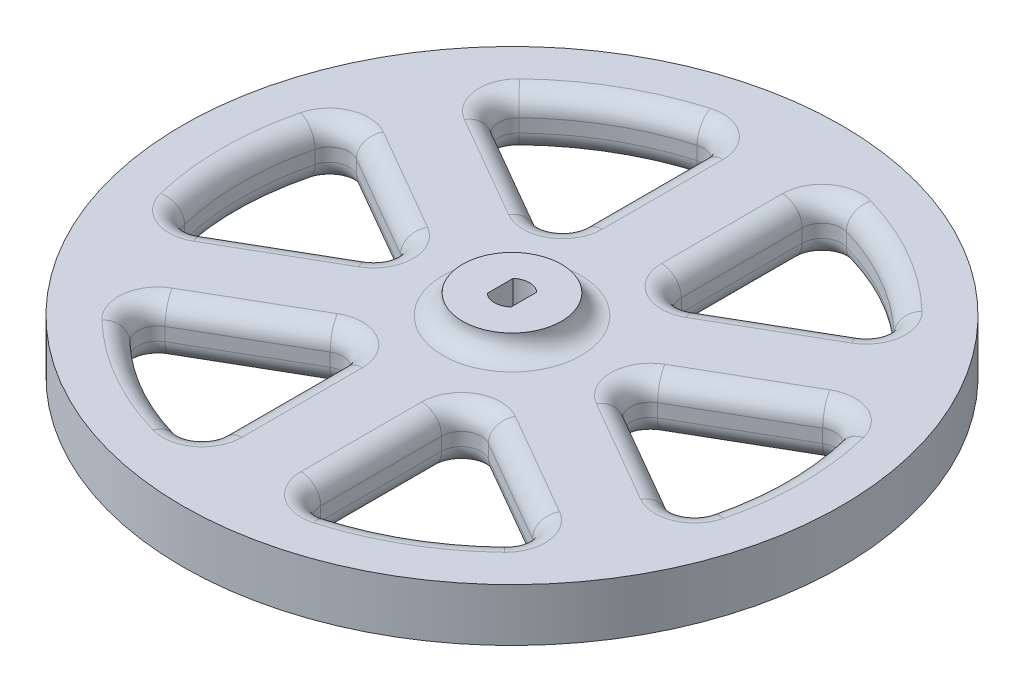
from build123d import *

# Parameters (mm, degrees)
SKETCH1_R           = 50
BOSS_EXTRUDE1_DEPTH = 8
SKETCH2_R           = 7.5
BOSS_EXTRUDE4_DEPTH = 3
CUT_EXTRUDE4_DEPTH  = 72.161787499
CUT_EXTRUDE6_DEPTH  = 72.161787499
FILLET4_R           = 3
FILLET5_R           = 3
FILLET6_R           = 3
FILLET7_R           = 3
FILLET8_R           = 3


with BuildPart() as part:
    # Sketch1 → Boss-Extrude1 (new body)
    with BuildSketch(Plane(origin=(0, 0, 0), x_dir=(1, 0, 0), z_dir=(0, 1, 0))):
        with Locations(Location((0, 0, 0), (0, 0, 270))):
            Circle(SKETCH1_R)
    extrude(amount=BOSS_EXTRUDE1_DEPTH)

    # Sketch2 → Boss-Extrude4 (add)
    with BuildSketch(Plane(origin=(0, 8, 0), x_dir=(1, 0, 0), z_dir=(0, 1, 0))):
        with Locations(Location((0, 0, 0), (0, 0, 270))):
            Circle(SKETCH2_R)
        with BuildLine():
            Line((-1.8, 1.944865034), (-1.8, -1.944865034))
            ThreePointArc((-1.8, -1.944865034), (0, -2.65), (1.8, -1.944865034))
            Line((1.8, -1.944865034), (1.8, 1.944865034))
            ThreePointArc((1.8, 1.944865034), (0, 2.65), (-1.8, 1.944865034))
        make_face(mode=Mode.SUBTRACT)
    extrude(amount=BOSS_EXTRUDE4_DEPTH)

    # Sketch5 → Cut-Extrude4 (cut, through all)
    with BuildSketch(Plane(origin=(0, 8, 0), x_dir=(1, 0, 0), z_dir=(0, 1, 0))):
        with BuildLine():
            Line((-1.8, 1.944865034), (-1.8, -1.944865034))
            ThreePointArc((-1.8, -1.944865034), (0, -2.65), (1.8, -1.944865034))
            Line((1.8, -1.944865034), (1.8, 1.944865034))
            ThreePointArc((1.8, 1.944865034), (0, 2.65), (-1.8, 1.944865034))
        make_face()
    extrude(amount=-CUT_EXTRUDE4_DEPTH, mode=Mode.SUBTRACT)

    # Sketch7 → Cut-Extrude6 (cut, through all)
    with BuildSketch(Plane(origin=(0, 8, 0), x_dir=(1, 0, 0), z_dir=(0, 1, 0))):
        with BuildLine():
            Line((-7.5, 40.308187754), (-7.5, 12.990381057))
            Line((-7.5, 12.990381057), (-31.157914575, 26.649284405))
            ThreePointArc((-31.157914575, 26.649284405), (-20.5, 35.507041555), (-7.5, 40.308187754))
        make_face()
        with BuildLine():
            Line((7.5, -40.308187754), (7.5, -12.990381057))
            Line((7.5, -12.990381057), (31.157914575, -26.649284405))
            ThreePointArc((31.157914575, -26.649284405), (20.5, -35.507041555), (7.5, -40.308187754))
        make_face()
        with BuildLine():
            Line((-38.657914575, 13.658903349), (-15, 0))
            Line((-15, 0), (-38.657914575, -13.658903349))
            ThreePointArc((-38.657914575, -13.658903349), (-41, 0), (-38.657914575, 13.658903349))
        make_face()
        with BuildLine():
            Line((-31.157914575, -26.649284405), (-7.5, -12.990381057))
            Line((-7.5, -12.990381057), (-7.5, -40.308187754))
            ThreePointArc((-7.5, -40.308187754), (-20.5, -35.507041555), (-31.157914575, -26.649284405))
        make_face()
        with BuildLine():
            Line((7.5, 12.990381057), (31.157914575, 26.649284405))
            ThreePointArc((31.157914575, 26.649284405), (20.5, 35.507041555), (7.5, 40.308187754))
            Line((7.5, 40.308187754), (7.5, 12.990381057))
        make_face()
        with BuildLine():
            Line((15, 0), (38.657914575, -13.658903349))
            ThreePointArc((38.657914575, -13.658903349), (41, 0), (38.657914575, 13.658903349))
            Line((38.657914575, 13.658903349), (15, 0))
        make_face()
    extrude(amount=-CUT_EXTRUDE6_DEPTH, mode=Mode.SUBTRACT)

    # Fillet4
    fillet4_edges = [part.edges().sort_by_distance(p)[0] for p in [
        (0, 8, -7.5),
    ]]
    fillet(fillet4_edges, radius=FILLET4_R - 0.0001)  # a hair under: the kernel refuses the full size

    # Fillet5
    fillet5_edges = [part.edges().sort_by_distance(p)[0] for p in [
        (7.5, 4, -40.308187754),
        (31.157914575, 4, -26.649284405),
        (31.157914575, 4, 26.649284405),
        (7.5, 4, 40.308187754),
        (38.657914575, 4, -13.658903349),
        (38.657914575, 4, 13.658903349),
        (-38.657914575, 4, 13.658903349),
        (-38.657914575, 4, -13.658903349),
        (-31.157914575, 4, -26.649284405),
        (-7.5, 4, -40.308187754),
        (-7.5, 4, 40.308187754),
        (-31.157914575, 4, 26.649284405),
    ]]
    fillet(fillet5_edges, radius=FILLET5_R)

    # Fillet6
    fillet6_edges = [part.edges().sort_by_distance(p)[0] for p in [
        (7.5, 4, -12.990381057),
        (7.5, 4, 12.990381057),
        (15, 4, 0),
        (-15, 4, 0),
        (-7.5, 4, -12.990381057),
        (-7.5, 4, 12.990381057),
    ]]
    fillet(fillet6_edges, radius=FILLET6_R)

    # Fillet7
    fillet7_edges = [part.edges().sort_by_distance(p)[0] for p in [
        (-19.938858637, 8, -20.171959439),
        (-20.5, 8, -35.507041555),
        (-20.5, 8, 35.507041555),
        (-41, 8, 0),
        (7.5, 8, -27.353537822),
        (20.5, 8, -35.507041555),
        (27.438858637, 8, -7.181578383),
        (41, 8, 0),
        (19.938858637, 8, 20.171959439),
        (20.5, 8, 35.507041555),
        (-7.5, 8, 27.353537822),
        (-27.438858637, 8, 7.181578383),
        (-29.355484575, 8, -26.988980691),
        (-29.355484575, 8, 26.988980691),
        (-38.050885189, 8, -11.928105037),
        (-8.695400613, 8, -38.917085728),
        (8.695400613, 8, -38.917085728),
        (38.050885189, 8, -11.928105037),
        (29.355484575, 8, 26.988980691),
        (-8.695400613, 8, 38.917085728),
        (-38.050885189, 8, 11.928105037),
        (8.695400613, 8, 38.917085728),
        (38.050885189, 8, 11.928105037),
        (29.355484575, 8, -26.988980691),
        (-27.438858637, 8, -7.181578383),
        (-19.938858637, 8, 20.171959439),
        (7.5, 8, 27.353537822),
        (27.438858637, 8, 7.181578383),
        (19.938858637, 8, -20.171959439),
        (-7.5, 8, -27.353537822),
        (-18, 8, 0),
        (-9, 8, 15.588457268),
        (9, 8, 15.588457268),
        (18, 8, 0),
        (9, 8, -15.588457268),
        (-9, 8, -15.588457268),
    ]]
    fillet(fillet7_edges, radius=FILLET7_R)

    # Fillet8
    fillet8_edges = [part.edges().sort_by_distance(p)[0] for p in [
        (-19.938858637, 0, -20.171959439),
        (-20.5, 0, -35.507041555),
        (-20.5, 0, 35.507041555),
        (-41, 0, 0),
        (7.5, 0, -27.353537822),
        (20.5, 0, -35.507041555),
        (27.438858637, 0, -7.181578383),
        (41, 0, 0),
        (19.938858637, 0, 20.171959439),
        (20.5, 0, 35.507041555),
        (-7.5, 0, 27.353537822),
        (-27.438858637, 0, 7.181578383),
        (-29.355484575, 0, -26.988980691),
        (-29.355484575, 0, 26.988980691),
        (-38.050885189, 0, -11.928105037),
        (-8.695400613, 0, -38.917085728),
        (8.695400613, 0, -38.917085728),
        (38.050885189, 0, -11.928105037),
        (29.355484575, 0, 26.988980691),
        (-8.695400613, 0, 38.917085728),
        (-38.050885189, 0, 11.928105037),
        (8.695400613, 0, 38.917085728),
        (38.050885189, 0, 11.928105037),
        (29.355484575, 0, -26.988980691),
        (-27.438858637, 0, -7.181578383),
        (-19.938858637, 0, 20.171959439),
        (7.5, 0, 27.353537822),
        (27.438858637, 0, 7.181578383),
        (19.938858637, 0, -20.171959439),
        (-7.5, 0, -27.353537822),
        (-18, 0, 0),
        (-9, 0, 15.588457268),
        (9, 0, 15.588457268),
        (18, 0, 0),
        (9, 0, -15.588457268),
        (-9, 0, -15.588457268),
    ]]
    fillet(fillet8_edges, radius=FILLET8_R)


solid = part.part
